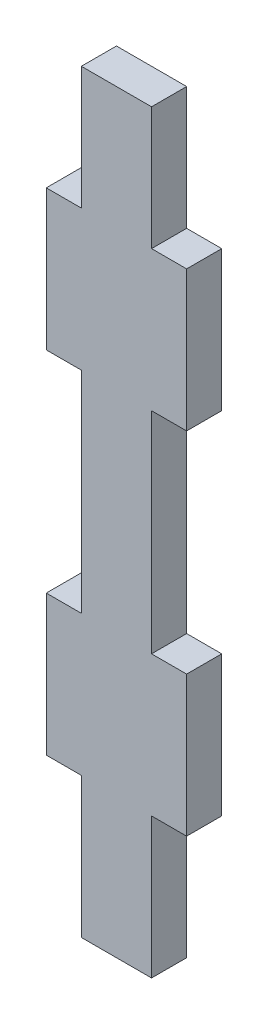
from build123d import *

# Parameters (mm, degrees)
SKETCH1_W           = 12.7
SKETCH1_H           = 136.525
BOSS_EXTRUDE1_DEPTH = 6.35
SKETCH2_W           = 6.35
SKETCH2_H           = 25.4
BOSS_EXTRUDE2_DEPTH = 6.35
LPATTERN1_COUNT     = 2
LPATTERN1_PITCH     = 63.5
SKETCH3_W           = 6.35
SKETCH3_H           = 25.4
BOSS_EXTRUDE3_DEPTH = 6.35
LPATTERN2_COUNT     = 2
LPATTERN2_PITCH     = 63.5


with BuildPart() as part:
    # Sketch1 → Boss-Extrude1 (new body)
    with BuildSketch(Plane.XY):
        with Locations((6.35, -76.2)):
            Rectangle(SKETCH1_W, SKETCH1_H)
    extrude(amount=BOSS_EXTRUDE1_DEPTH)

    # Sketch2 → Boss-Extrude2 (add)
    with BuildSketch(Plane.ZY):
        with Locations((3.175, -106.3625)):
            Rectangle(SKETCH2_W, SKETCH2_H)
    boss_extrude2 = extrude(amount=BOSS_EXTRUDE2_DEPTH)

    # LPattern1: Boss-Extrude2 ×2
    with Locations(*[(0, i * LPATTERN1_PITCH, 0) for i in range(1, LPATTERN1_COUNT)]):
        add(boss_extrude2)

    # Sketch3 → Boss-Extrude3 (add)
    with BuildSketch(Plane(origin=(12.7, 0, 0), x_dir=(0, 0, -1), z_dir=(1, 0, 0))):
        with Locations((-3.175, -106.3625)):
            Rectangle(SKETCH3_W, SKETCH3_H)
    boss_extrude3 = extrude(amount=BOSS_EXTRUDE3_DEPTH)

    # LPattern2: Boss-Extrude3 ×2
    with Locations(*[(0, i * LPATTERN2_PITCH, 0) for i in range(1, LPATTERN2_COUNT)]):
        add(boss_extrude3)


solid = part.part
